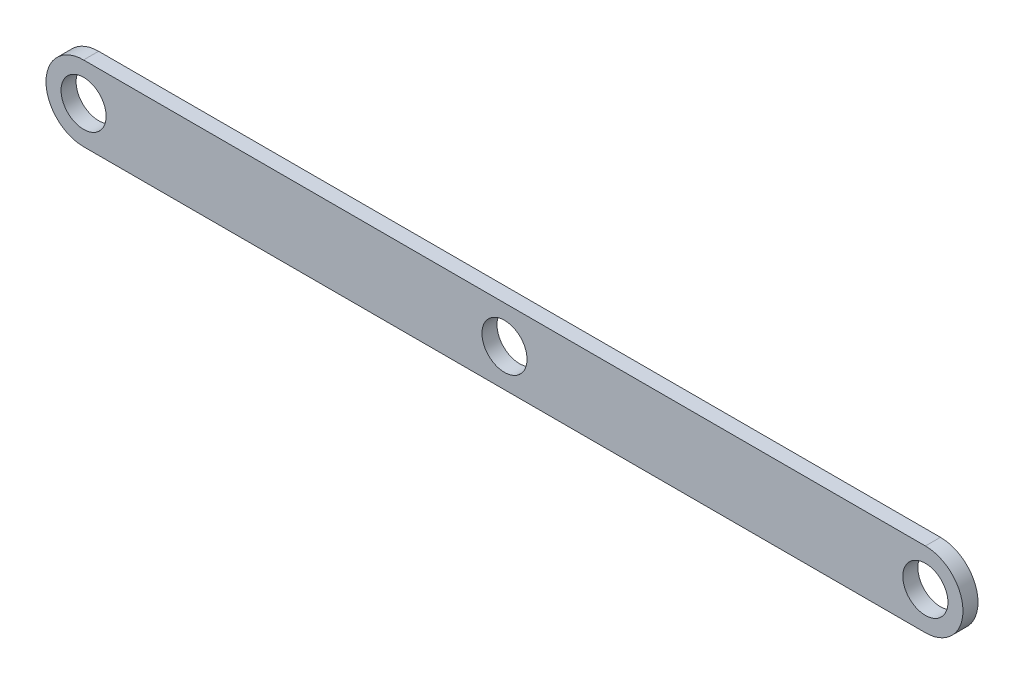
from build123d import *

# Parameters (mm, degrees)
SKETCH1_R           = 4.7625
BOSS_EXTRUDE1_DEPTH = 3.175


with BuildPart() as part:
    # Sketch1 → Boss-Extrude1 (new body)
    with BuildSketch(Plane.XY):
        with BuildLine():
            Line((-88.9, 7.9375), (88.9, 7.9375))
            ThreePointArc((88.9, 7.9375), (96.8375, 0), (88.9, -7.9375))
            Line((88.9, -7.9375), (-88.9, -7.9375))
            ThreePointArc((-88.9, -7.9375), (-96.8375, 0), (-88.9, 7.9375))
        make_face()
        with Locations((-88.9, 0)):
            Circle(SKETCH1_R, mode=Mode.SUBTRACT)
        with Locations((88.9, 0)):
            Circle(SKETCH1_R, mode=Mode.SUBTRACT)
        Circle(SKETCH1_R, mode=Mode.SUBTRACT)
    extrude(amount=BOSS_EXTRUDE1_DEPTH)


solid = part.part
